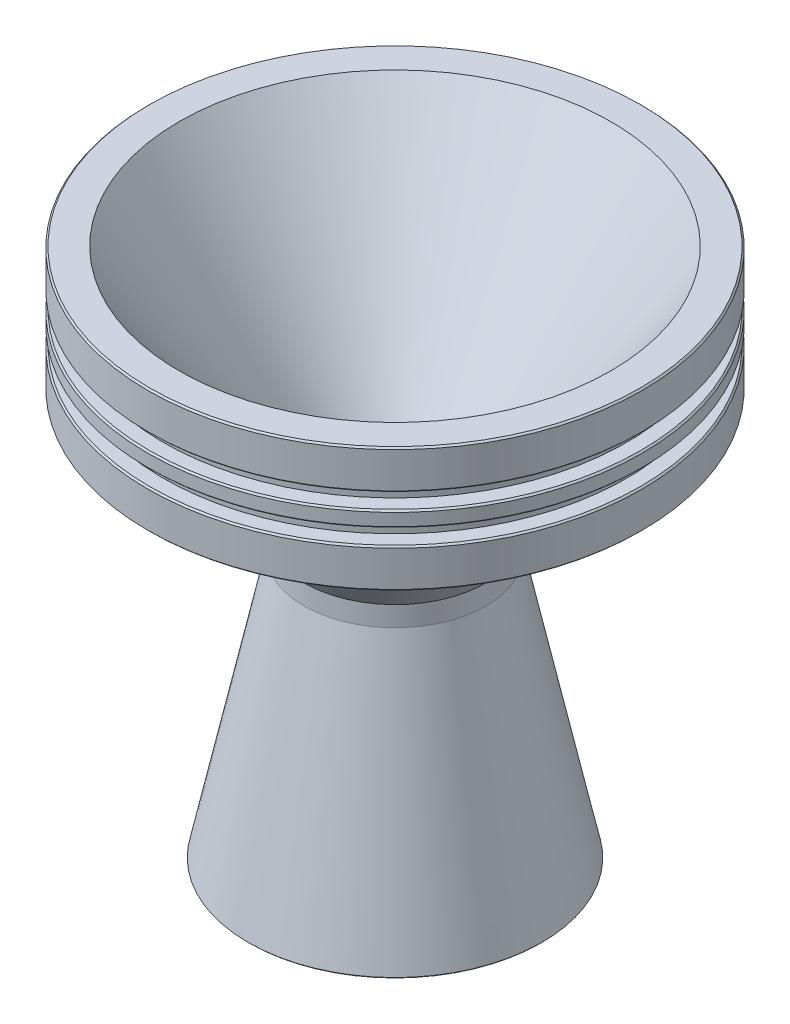
from build123d import *
from OCP.BRepFilletAPI import BRepFilletAPI_MakeChamfer

# Parameters (mm, degrees)
OUTER_CHAMFERS_SIZE  = 0.127
OUTER_CHAMFERS_SIZE2 = 0.107077278


with BuildPart() as part:
    # Sketch1 → base_revolve (revolve)
    with BuildSketch(Plane.XY):
        Polygon((0, 0), (2.54, 0), (16.002, -19.225728467), (16.002, -21.765728467), (11.403513456, -43.399906719), (8.157582067, -43.399906719), (12.756068611, -21.765728467), (12.756068611, -20.1255016), (5.778149269, -10.16), (0, -10.16), (0, -6.985), (1.27, -6.985), (1.27, -5.715), (0, -5.715), (0, -4.445), (1.27, -4.445), (1.27, -3.175), (0, -3.175), align=None)
    revolve(axis=Axis((20.193, 0, 0), (0, -1, 0)))

    # outer_chamfers: one chamfer whose edges measure the first distance from different faces: ONE call of the kernel's chamfer builder (chamfer() names one face for all edges)
    outer_chamfers_edges_1 = [part.edges().sort_by_distance(p)[0] for p in [
        (40.386, -10.16, 0),
        (40.386, 0, 0),
        (40.386, -5.715, 0),
        (40.386, -6.985, 0),
        (40.386, -4.445, 0),
        (40.386, -3.175, 0),
    ]]
    outer_chamfers_edges_2 = [part.edges().sort_by_distance(p)[0] for p in [
        (32.228417933, -43.399906719, 0),
    ]]
    outer_chamfers_side_2 = [part.faces().sort_by_distance(p)[0] for p in [
        (29.322899569, -43.399906719, 0),
    ]]
    outer_chamfers = BRepFilletAPI_MakeChamfer(part.part.solid().wrapped)
    for e in outer_chamfers_edges_1:
        outer_chamfers.Add(OUTER_CHAMFERS_SIZE, e.wrapped)
    for e in outer_chamfers_edges_2:
        outer_chamfers.Add(OUTER_CHAMFERS_SIZE, OUTER_CHAMFERS_SIZE2, e.wrapped, outer_chamfers_side_2[0].wrapped)  # the first distance lies on this face
    add(Compound.cast(outer_chamfers.Shape()), mode=Mode.REPLACE)


solid = part.part
